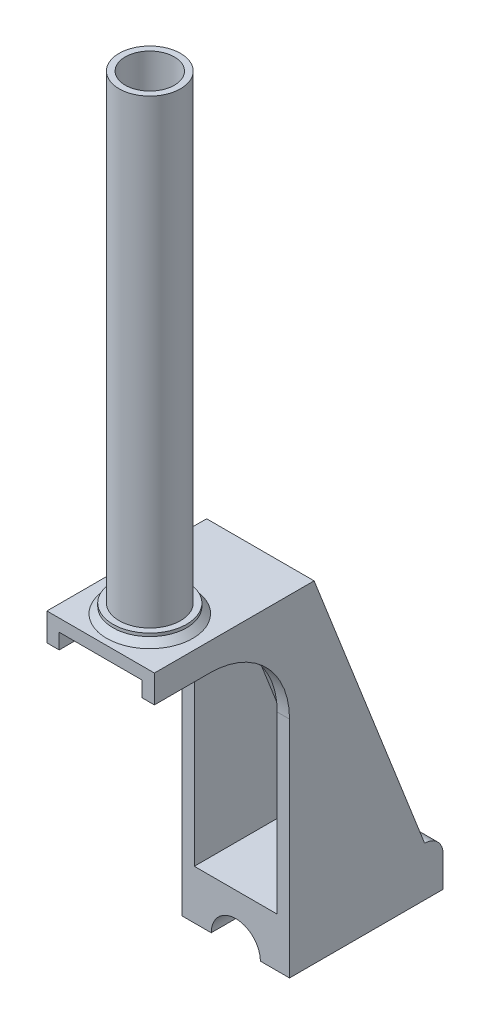
from build123d import *

# Parameters (mm, degrees)
SKETCH2_W           = 50
SKETCH2_H           = 16
BOSS_EXTRUDE1_DEPTH = 17.5
SKETCH3_R           = 8
CUT_EXTRUDE1_DEPTH  = 182.811028268
BOSS_EXTRUDE2_START = -3
SKETCH4_W           = 16
SKETCH4_H           = 3
BOSS_EXTRUDE2_DEPTH = 43
FILLET1_R           = 0.5
FILLET2_R           = 6
SKETCH6_R           = 3
CUT_EXTRUDE3_DEPTH  = 12
BOSS_EXTRUDE3_DEPTH = 4
BOSS_EXTRUDE5_START = -35
BOSS_EXTRUDE5_DEPTH = 4
SKETCH8_W           = 27
SKETCH8_H           = 52
SKETCH8_R           = 10
BOSS_EXTRUDE6_DEPTH = 4
CHAMFER1_SIZE2      = 4
CHAMFER1_SIZE       = 3
SKETCH9_W           = 27
SKETCH9_H           = 98.792712282
BOSS_EXTRUDE7_DEPTH = 4
CHAMFER2_SIZE       = 2


with BuildPart() as part:
    # Sketch1 → Revolve1 (revolve)
    with BuildSketch(Plane(origin=(0, 0, 0), x_dir=(0, 0, -1), z_dir=(1, 0, 0))):
        Polygon((8, 157), (8, 0), (10, 0), (10, 4), (12, 4), (12, 7), (10, 7), (10, 157), align=None)
    revolve(axis=Axis((0, 0, 0), (0, 1, 0)))



with BuildPart() as body_2:
    # Sketch2 → Boss-Extrude1 (new, symmetric)
    with BuildSketch(Plane(origin=(0, 0, 0), x_dir=(0, 0, -1), z_dir=(1, 0, 0))):
        with Locations((53, -96)):
            Rectangle(SKETCH2_W, SKETCH2_H)
    extrude(amount=BOSS_EXTRUDE1_DEPTH, both=True)

    # Sketch3 → Cut-Extrude1 (cut, through all)
    with BuildSketch(Plane(origin=(0, 0, -78), x_dir=(-1, 0, 0), z_dir=(0, 0, -1))):
        with Locations((0, -104)):
            Circle(SKETCH3_R)
    extrude(amount=-CUT_EXTRUDE1_DEPTH, mode=Mode.SUBTRACT)

    # Sketch4 → Boss-Extrude2 (add)
    with BuildSketch(Plane(origin=(0, 0, -78), x_dir=(-1, 0, 0), z_dir=(0, 0, -1)).offset(BOSS_EXTRUDE2_START)):
        with Locations((0, -97.5)):
            Rectangle(SKETCH4_W, SKETCH4_H)
    extrude(amount=-BOSS_EXTRUDE2_DEPTH)

    # Fillet1
    fillet1_edges = [body_2.edges().sort_by_distance(p)[0] for p in [
        (0, -99, -32),
        (0, -99, -75),
    ]]
    fillet(fillet1_edges, radius=FILLET1_R)

    # Fillet2
    fillet2_edges = [body_2.edges().sort_by_distance(p)[0] for p in [
        (0, -88, -78),
    ]]
    fillet(fillet2_edges, radius=FILLET2_R)

    # Sketch6 → Cut-Extrude3 (cut)
    with BuildSketch(Plane.XZ.offset(104)):
        with Locations(Location((-12.5, -34, 0), (0, 0, 270))):
            Circle(SKETCH6_R)
        with Locations(Location((12.5, -34, 0), (0, 0, 270))):
            Circle(SKETCH6_R)
        with Locations(Location((-12.5, -72, 0), (0, 0, 270))):
            Circle(SKETCH6_R)
        with Locations(Location((12.5, -72, 0), (0, 0, 270))):
            Circle(SKETCH6_R)
    extrude(amount=-CUT_EXTRUDE3_DEPTH, mode=Mode.SUBTRACT)


with BuildPart() as body_3:
    # Sketch7 → Boss-Extrude3 (new body)
    with BuildSketch(Plane.ZY.offset(17.5)):
        with BuildLine():
            Line((-72, -88), (-36, 4))
            Line((-36, 4), (16, 4))
            Line((16, 4), (16, -5))
            Line((16, -5), (-2, -5))
            ThreePointArc((-2, -5), (-20.384776311, -12.615223689), (-28, -31))
            Line((-28, -31), (-28, -88))
            Line((-28, -88), (-72, -88))
        make_face()
    extrude(amount=-BOSS_EXTRUDE3_DEPTH)


with BuildPart() as body_4:
    # Sketch7<2> → Boss-Extrude5 (new body)
    with BuildSketch(Plane.ZY.offset(17.5).offset(BOSS_EXTRUDE5_START)):
        with BuildLine():
            Line((-72, -88), (-36, 4))
            Line((-36, 4), (16, 4))
            Line((16, 4), (16, -5))
            Line((16, -5), (-2, -5))
            ThreePointArc((-2, -5), (-20.384776311, -12.615223689), (-28, -31))
            Line((-28, -31), (-28, -88))
            Line((-28, -88), (-72, -88))
        make_face()
    extrude(amount=BOSS_EXTRUDE5_DEPTH)


with BuildPart() as part_1:
    add(part.part)

    add(body_3.part)  # Boss-Extrude6 merges body 3

    add(body_4.part)  # Boss-Extrude6 merges body 4
    # Sketch8 → Boss-Extrude6 (add)
    with BuildSketch(Plane.XZ.offset(-4)):
        with Locations((0, -10)):
            Rectangle(SKETCH8_W, SKETCH8_H)
        with Locations(Location((0, 0, 0), (0, 0, 270))):
            Circle(SKETCH8_R, mode=Mode.SUBTRACT)
    extrude(amount=BOSS_EXTRUDE6_DEPTH)

    # Chamfer1
    chamfer1_edges = [part_1.edges().sort_by_distance(p)[0] for p in [
        (0, 0, -36),
    ]]
    chamfer1_side = [part_1.faces().sort_by_distance(p)[0] for p in [
        (0, 0, -35.94),
    ]]
    chamfer(chamfer1_edges, length=CHAMFER1_SIZE - 0.0001, length2=CHAMFER1_SIZE2 - 0.0001, reference=chamfer1_side[0])  # a hair under: the kernel refuses the full size


    add(body_2.part)  # Boss-Extrude7 merges body 2
    # Sketch9 → Boss-Extrude7 (add)
    with BuildSketch(Plane(origin=(0, 12.747540984, -32.57704918), x_dir=(-1, 0, 0), z_dir=(0, 0.3643993485805124, -0.9312427797057534))):
        with Locations((0, -58.789761571)):
            Rectangle(SKETCH9_W, SKETCH9_H)
    extrude(amount=-BOSS_EXTRUDE7_DEPTH)

    # Chamfer2
    chamfer2_edges = [part_1.edges().sort_by_distance(p)[0] for p in [
        (0, 4, 12),
    ]]
    chamfer(chamfer2_edges, length=CHAMFER2_SIZE)


solid = part_1.part
